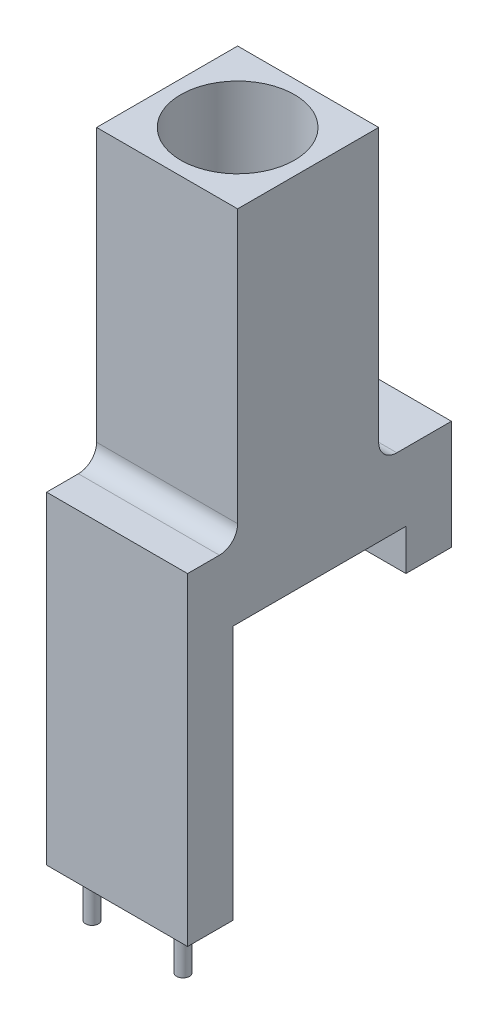
from build123d import *

# Parameters (mm, degrees)
BOSS_EXTRUDE1_DEPTH = 31
SKETCH3_R           = 12.5
CUT_EXTRUDE1_DEPTH  = 87.208303263
SKETCH4_W           = 31
SKETCH4_H           = 15
BOSS_EXTRUDE2_DEPTH = 11
SKETCH5_W           = 31
SKETCH5_H           = 10
BOSS_EXTRUDE3_DEPTH = 56
SKETCH6_R           = 1.4
BOSS_EXTRUDE4_DEPTH = 10
SKETCH7_W           = 31
SKETCH7_H           = 15
BOSS_EXTRUDE5_DEPTH = 16
SKETCH8_W           = 31
SKETCH8_H           = 10
BOSS_EXTRUDE6_DEPTH = 9
FILLET1_R           = 4


with BuildPart() as part:
    # Sketch1 → Boss-Extrude1 (new body)
    with BuildSketch(Plane.XY):
        with BuildLine():
            Line((-15.5, 107.5), (-15.5, 28.565713714))
            ThreePointArc((-15.5, 28.565713714), (0, 32.5), (15.5, 28.565713714))
            Line((15.5, 28.565713714), (15.5, 107.5))
            Line((15.5, 107.5), (-15.5, 107.5))
        make_face()
    extrude(amount=BOSS_EXTRUDE1_DEPTH)

    # Sketch3 → Cut-Extrude1 (cut, through all)
    with BuildSketch(Plane(origin=(0, 107.5, 0), x_dir=(1, 0, 0), z_dir=(0, 1, 0))):
        with Locations((0, -15.5)):
            Circle(SKETCH3_R)
    extrude(amount=-CUT_EXTRUDE1_DEPTH, mode=Mode.SUBTRACT)

    # Sketch4 → Boss-Extrude2 (add)
    with BuildSketch(Plane.XY.offset(31)):
        with Locations((0, 36.065713714)):
            Rectangle(SKETCH4_W, SKETCH4_H)
    extrude(amount=BOSS_EXTRUDE2_DEPTH)

    # Sketch5 → Boss-Extrude3 (add)
    with BuildSketch(Plane.XZ.offset(-28.565713714)):
        with Locations((0, 37)):
            Rectangle(SKETCH5_W, SKETCH5_H)
    extrude(amount=BOSS_EXTRUDE3_DEPTH)

    # Sketch6 → Boss-Extrude4 (add)
    with BuildSketch(Plane.XZ.offset(27.434286286)):
        with Locations((-10, 37.5)):
            Circle(SKETCH6_R)
        with Locations((10, 37.5)):
            Circle(SKETCH6_R)
    extrude(amount=BOSS_EXTRUDE4_DEPTH)

    # Sketch7 → Boss-Extrude5 (add)
    with BuildSketch(Plane(origin=(0, 0, 0), x_dir=(-1, 0, 0), z_dir=(0, 0, -1))):
        with Locations((0, 36.065713714)):
            Rectangle(SKETCH7_W, SKETCH7_H)
    extrude(amount=BOSS_EXTRUDE5_DEPTH)

    # Sketch8 → Boss-Extrude6 (add)
    with BuildSketch(Plane.XZ.offset(-28.565713714)):
        with Locations((0, -11)):
            Rectangle(SKETCH8_W, SKETCH8_H)
    extrude(amount=BOSS_EXTRUDE6_DEPTH)

    # Fillet1
    fillet1_edges = [part.edges().sort_by_distance(p)[0] for p in [
        (0, 43.565713714, 31),
        (0, 43.565713714, 0),
    ]]
    fillet(fillet1_edges, radius=FILLET1_R)


solid = part.part
